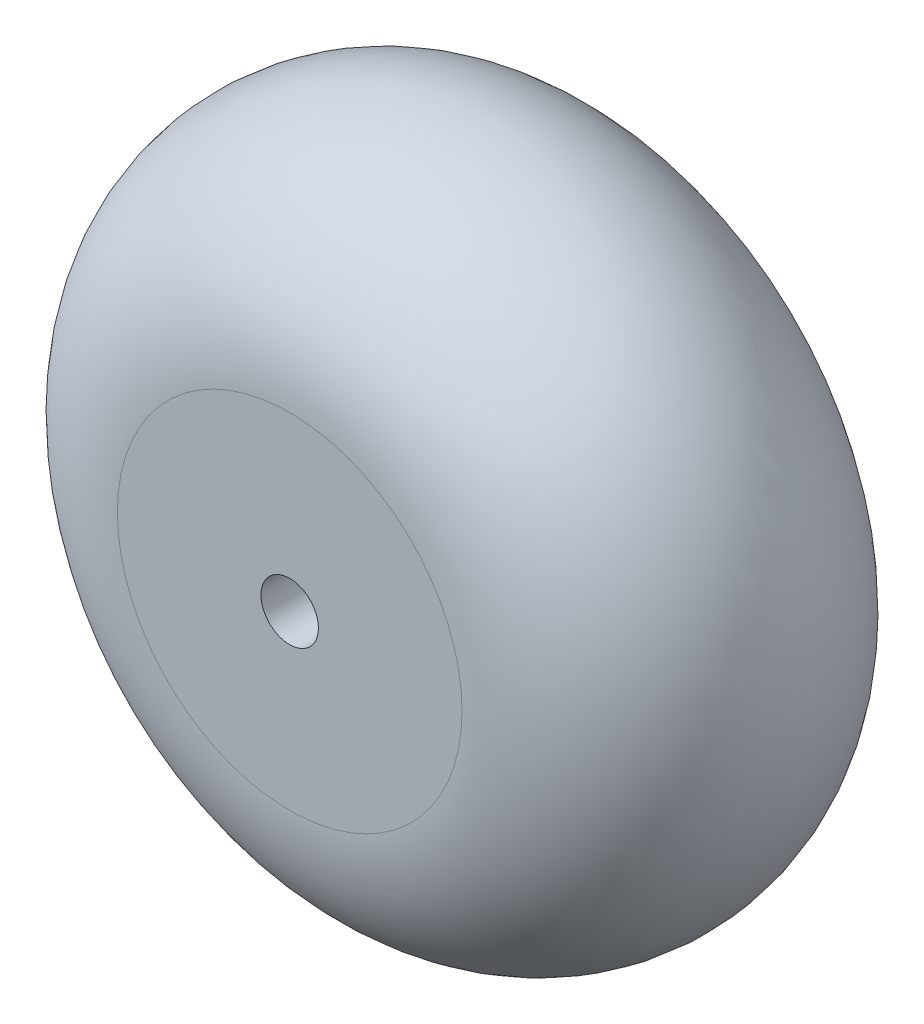
from build123d import *

# Parameters (mm, degrees)
SKETCH1_R           = 30
BOSS_EXTRUDE1_DEPTH = 30
FILLET1_R           = 15
SKETCH2_R           = 2.5
CUT_EXTRUDE1_DEPTH  = 52.961524227


with BuildPart() as part:
    # Sketch1 → Boss-Extrude1 (new body)
    with BuildSketch(Plane.XY):
        Circle(SKETCH1_R)
    extrude(amount=BOSS_EXTRUDE1_DEPTH)

    # Fillet1
    fillet1_edges = [part.edges().sort_by_distance(p)[0] for p in [
        (-30, 0, 0),
        (-30, 0, 30),
    ]]
    fillet(fillet1_edges, radius=FILLET1_R - 0.0001)  # a hair under: the kernel refuses the full size

    # Sketch2 → Cut-Extrude1 (cut, through all)
    with BuildSketch(Plane(origin=(0, 0, 0), x_dir=(-1, 0, 0), z_dir=(0, 0, -1))):
        Circle(SKETCH2_R)
    extrude(amount=-CUT_EXTRUDE1_DEPTH, mode=Mode.SUBTRACT)


solid = part.part
